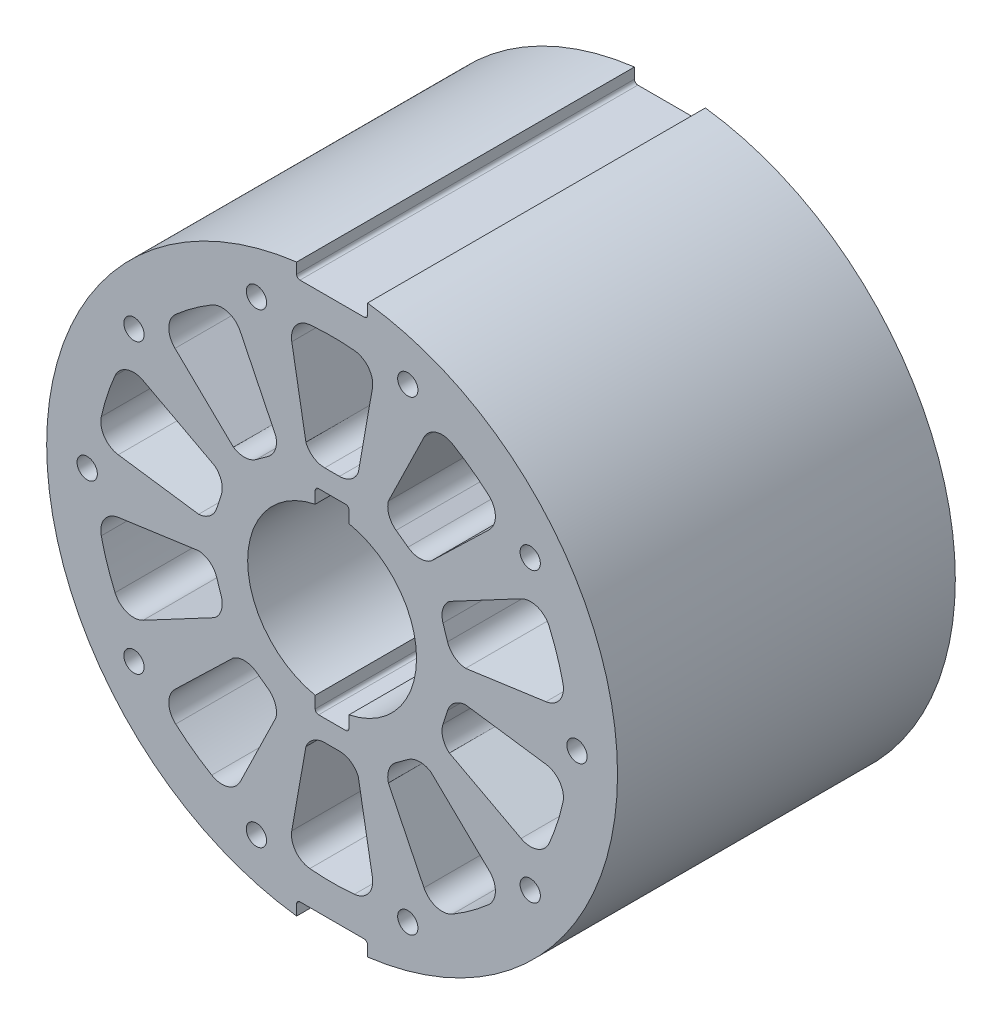
from build123d import *

# Parameters (mm, degrees)
MODEL_R                     = 3
Y_KSEKLIK_EKSTR_ZYON5_DEPTH = 100


with BuildPart() as part:
    # Model → Yükseklik-Ekstrüzyon5 (new body)
    with BuildSketch(Plane.XY):
        with BuildLine():
            Line((9.5, 79.70485754), (-9.5, 79.70485754))
            ThreePointArc((-9.5, 79.70485754), (-10.207106781, 79.997750759), (-10.5, 80.70485754))
            Line((-10.5, 80.70485754), (-10.5, 83.845095265))
            ThreePointArc((-10.5, 83.845095265), (-84.5, 0), (-10.5, -83.845095265))
            Line((-10.5, -83.845095265), (-10.5, -80.70485754))
            ThreePointArc((-10.5, -80.70485754), (-10.207106781, -79.997750759), (-9.5, -79.70485754))
            Line((-9.5, -79.70485754), (9.5, -79.70485754))
            ThreePointArc((9.5, -79.70485754), (10.207106781, -79.997750759), (10.5, -80.70485754))
            Line((10.5, -80.70485754), (10.5, -83.845095265))
            ThreePointArc((10.5, -83.845095265), (84.5, 0), (10.5, 83.845095265))
            Line((10.5, 83.845095265), (10.5, 80.70485754))
            ThreePointArc((10.5, 80.70485754), (10.207106781, 79.997750759), (9.5, 79.70485754))
        make_face()
        with Locations((-58.653732092, -42.614430791)):
            Circle(MODEL_R, mode=Mode.SUBTRACT)
        with Locations((-22.403732092, -68.951597431)):
            Circle(MODEL_R, mode=Mode.SUBTRACT)
        with BuildLine():
            ThreePointArc((-18.940576577, -29.779008555), (-16.820231104, -32.605612708), (-16.658403576, -36.135395679))
            Line((-16.658403576, -36.135395679), (-27.194108178, -57.736791298))
            ThreePointArc((-27.194108178, -57.736791298), (-30.862591163, -60.853463931), (-35.640908554, -60.271142184))
            ThreePointArc((-35.640908554, -60.271142184), (-41.157078213, -56.647858351), (-46.307616081, -52.521325533))
            ThreePointArc((-46.307616081, -52.521325533), (-48.338018251, -48.156822957), (-46.50751002, -43.7047835))
            Line((-46.50751002, -43.7047835), (-29.219073725, -27.009534635))
            ThreePointArc((-29.219073725, -27.009534635), (-25.812043174, -26.072678835), (-22.46856009, -27.215778495))
            Line((-22.46856009, -27.215778495), (-18.940576577, -29.779008555))
        make_face(mode=Mode.SUBTRACT)
        with BuildLine():
            ThreePointArc((2.180413722, -35.224715579), (5.55724548, -36.265178576), (7.762921073, -39.025713151))
            Line((7.762921073, -39.025713151), (11.936338777, -62.694341097))
            ThreePointArc((11.936338777, -62.694341097), (10.800407909, -67.37206242), (6.592387799, -69.709578724))
            ThreePointArc((6.592387799, -69.709578724), (0, -70.020603702), (-6.592387799, -69.709578724))
            ThreePointArc((-6.592387799, -69.709578724), (-10.800407909, -67.37206242), (-11.936338777, -62.694341097))
            Line((-11.936338777, -62.694341097), (-7.762921073, -39.025713151))
            ThreePointArc((-7.762921073, -39.025713151), (-5.55724548, -36.265178576), (-2.180413722, -35.224715579))
            Line((-2.180413722, -35.224715579), (2.180413722, -35.224715579))
        make_face(mode=Mode.SUBTRACT)
        with BuildLine():
            ThreePointArc((-32.826910391, -12.958732415), (-32.772951104, -16.49181101), (-34.716784258, -19.442585254))
            Line((-34.716784258, -19.442585254), (-55.937330103, -30.725749625))
            ThreePointArc((-55.937330103, -30.725749625), (-60.737129391, -31.090910554), (-64.26058923, -27.811177871))
            ThreePointArc((-64.26058923, -27.811177871), (-66.593551426, -21.6375565), (-68.334908957, -15.271711122))
            ThreePointArc((-68.334908957, -15.271711122), (-67.412148571, -10.547313914), (-63.314393168, -8.021484076))
            Line((-63.314393168, -8.021484076), (-39.514533333, -4.676631909))
            ThreePointArc((-39.514533333, -4.676631909), (-36.207517694, -5.921301958), (-34.174480181, -8.811339057))
            Line((-34.174480181, -8.811339057), (-32.826910391, -12.958732415))
        make_face(mode=Mode.SUBTRACT)
        with Locations((22.403732092, -68.951597431)):
            Circle(MODEL_R, mode=Mode.SUBTRACT)
        with BuildLine():
            ThreePointArc((22.46856009, -27.215778495), (25.812043174, -26.072678835), (29.219073725, -27.009534635))
            Line((29.219073725, -27.009534635), (46.50751002, -43.7047835))
            ThreePointArc((46.50751002, -43.7047835), (48.338018251, -48.156822957), (46.307616081, -52.521325533))
            ThreePointArc((46.307616081, -52.521325533), (41.157078213, -56.647858351), (35.640908554, -60.271142184))
            ThreePointArc((35.640908554, -60.271142184), (30.862591163, -60.853463931), (27.194108178, -57.736791298))
            Line((27.194108178, -57.736791298), (16.658403576, -36.135395679))
            ThreePointArc((16.658403576, -36.135395679), (16.820231104, -32.605612708), (18.940576577, -29.779008555))
            Line((18.940576577, -29.779008555), (22.46856009, -27.215778495))
        make_face(mode=Mode.SUBTRACT)
        with Locations((58.653732092, -42.614430791)):
            Circle(MODEL_R, mode=Mode.SUBTRACT)
        with BuildLine():
            ThreePointArc((34.174480181, -8.811339057), (36.207517694, -5.921301958), (39.514533333, -4.676631909))
            Line((39.514533333, -4.676631909), (63.314393168, -8.021484076))
            ThreePointArc((63.314393168, -8.021484076), (67.412148571, -10.547313914), (68.334908957, -15.271711122))
            ThreePointArc((68.334908957, -15.271711122), (66.593551426, -21.6375565), (64.26058923, -27.811177871))
            ThreePointArc((64.26058923, -27.811177871), (60.737129391, -31.090910554), (55.937330103, -30.725749625))
            Line((55.937330103, -30.725749625), (34.716784258, -19.442585254))
            ThreePointArc((34.716784258, -19.442585254), (32.772951104, -16.49181101), (32.826910391, -12.958732415))
            Line((32.826910391, -12.958732415), (34.174480181, -8.811339057))
        make_face(mode=Mode.SUBTRACT)
        with Locations((72.5, 0)):
            Circle(MODEL_R, mode=Mode.SUBTRACT)
        with Locations((-72.5, 0)):
            Circle(MODEL_R, mode=Mode.SUBTRACT)
        with BuildLine():
            ThreePointArc((-34.174480181, 8.811339057), (-36.207517694, 5.921301958), (-39.514533333, 4.676631909))
            Line((-39.514533333, 4.676631909), (-63.314393168, 8.021484076))
            ThreePointArc((-63.314393168, 8.021484076), (-67.412148571, 10.547313914), (-68.334908957, 15.271711122))
            ThreePointArc((-68.334908957, 15.271711122), (-66.593551426, 21.6375565), (-64.26058923, 27.811177871))
            ThreePointArc((-64.26058923, 27.811177871), (-60.737129391, 31.090910554), (-55.937330103, 30.725749625))
            Line((-55.937330103, 30.725749625), (-34.716784258, 19.442585254))
            ThreePointArc((-34.716784258, 19.442585254), (-32.772951104, 16.49181101), (-32.826910391, 12.958732415))
            Line((-32.826910391, 12.958732415), (-34.174480181, 8.811339057))
        make_face(mode=Mode.SUBTRACT)
        with Locations((-58.653732092, 42.614430791)):
            Circle(MODEL_R, mode=Mode.SUBTRACT)
        with BuildLine():
            ThreePointArc((-22.46856009, 27.215778495), (-25.812043174, 26.072678835), (-29.219073725, 27.009534635))
            Line((-29.219073725, 27.009534635), (-46.50751002, 43.7047835))
            ThreePointArc((-46.50751002, 43.7047835), (-48.338018251, 48.156822957), (-46.307616081, 52.521325533))
            ThreePointArc((-46.307616081, 52.521325533), (-41.157078213, 56.647858351), (-35.640908554, 60.271142184))
            ThreePointArc((-35.640908554, 60.271142184), (-30.862591163, 60.853463931), (-27.194108178, 57.736791298))
            Line((-27.194108178, 57.736791298), (-16.658403576, 36.135395679))
            ThreePointArc((-16.658403576, 36.135395679), (-16.820231104, 32.605612708), (-18.940576577, 29.779008555))
            Line((-18.940576577, 29.779008555), (-22.46856009, 27.215778495))
        make_face(mode=Mode.SUBTRACT)
        with BuildLine():
            ThreePointArc((-2.180413722, 35.224715579), (-5.55724548, 36.265178576), (-7.762921073, 39.025713151))
            Line((-7.762921073, 39.025713151), (-11.936338777, 62.694341097))
            ThreePointArc((-11.936338777, 62.694341097), (-10.800407909, 67.37206242), (-6.592387799, 69.709578724))
            ThreePointArc((-6.592387799, 69.709578724), (0, 70.020603702), (6.592387799, 69.709578724))
            ThreePointArc((6.592387799, 69.709578724), (10.800407909, 67.37206242), (11.936338777, 62.694341097))
            Line((11.936338777, 62.694341097), (7.762921073, 39.025713151))
            ThreePointArc((7.762921073, 39.025713151), (5.55724548, 36.265178576), (2.180413722, 35.224715579))
            Line((2.180413722, 35.224715579), (-2.180413722, 35.224715579))
        make_face(mode=Mode.SUBTRACT)
        with Locations((-22.403732092, 68.951597431)):
            Circle(MODEL_R, mode=Mode.SUBTRACT)
        with BuildLine():
            Line((-5, -27.989794856), (-5, -24.494897428))
            ThreePointArc((-5, -24.494897428), (-25, 0), (-5, 24.494897428))
            Line((-5, 24.494897428), (-5, 27.989794856))
            ThreePointArc((-5, 27.989794856), (-4.707106781, 28.696901637), (-4, 28.989794856))
            Line((-4, 28.989794856), (0, 28.989794856))
            Line((0, 28.989794856), (4, 28.989794856))
            ThreePointArc((4, 28.989794856), (4.707106781, 28.696901637), (5, 27.989794856))
            Line((5, 27.989794856), (5, 24.494897428))
            ThreePointArc((5, 24.494897428), (25, 0), (5, -24.494897428))
            Line((5, -24.494897428), (5, -27.989794856))
            ThreePointArc((5, -27.989794856), (4.707106781, -28.696901637), (4, -28.989794856))
            Line((4, -28.989794856), (0, -28.989794856))
            Line((0, -28.989794856), (-4, -28.989794856))
            ThreePointArc((-4, -28.989794856), (-4.707106781, -28.696901637), (-5, -27.989794856))
        make_face(mode=Mode.SUBTRACT)
        with BuildLine():
            ThreePointArc((32.826910391, 12.958732415), (32.772951104, 16.49181101), (34.716784258, 19.442585254))
            Line((34.716784258, 19.442585254), (55.937330103, 30.725749625))
            ThreePointArc((55.937330103, 30.725749625), (60.737129391, 31.090910554), (64.26058923, 27.811177871))
            ThreePointArc((64.26058923, 27.811177871), (66.593551426, 21.6375565), (68.334908957, 15.271711122))
            ThreePointArc((68.334908957, 15.271711122), (67.412148571, 10.547313914), (63.314393168, 8.021484076))
            Line((63.314393168, 8.021484076), (39.514533333, 4.676631909))
            ThreePointArc((39.514533333, 4.676631909), (36.207517694, 5.921301958), (34.174480181, 8.811339057))
            Line((34.174480181, 8.811339057), (32.826910391, 12.958732415))
        make_face(mode=Mode.SUBTRACT)
        with BuildLine():
            ThreePointArc((18.940576577, 29.779008555), (16.820231104, 32.605612708), (16.658403576, 36.135395679))
            Line((16.658403576, 36.135395679), (27.194108178, 57.736791298))
            ThreePointArc((27.194108178, 57.736791298), (30.862591163, 60.853463931), (35.640908554, 60.271142184))
            ThreePointArc((35.640908554, 60.271142184), (41.157078213, 56.647858351), (46.307616081, 52.521325533))
            ThreePointArc((46.307616081, 52.521325533), (48.338018251, 48.156822957), (46.50751002, 43.7047835))
            Line((46.50751002, 43.7047835), (29.219073725, 27.009534635))
            ThreePointArc((29.219073725, 27.009534635), (25.812043174, 26.072678835), (22.46856009, 27.215778495))
            Line((22.46856009, 27.215778495), (18.940576577, 29.779008555))
        make_face(mode=Mode.SUBTRACT)
        with Locations((22.403732092, 68.951597431)):
            Circle(MODEL_R, mode=Mode.SUBTRACT)
        with Locations((58.653732092, 42.614430791)):
            Circle(MODEL_R, mode=Mode.SUBTRACT)
    extrude(amount=Y_KSEKLIK_EKSTR_ZYON5_DEPTH)


solid = part.part
